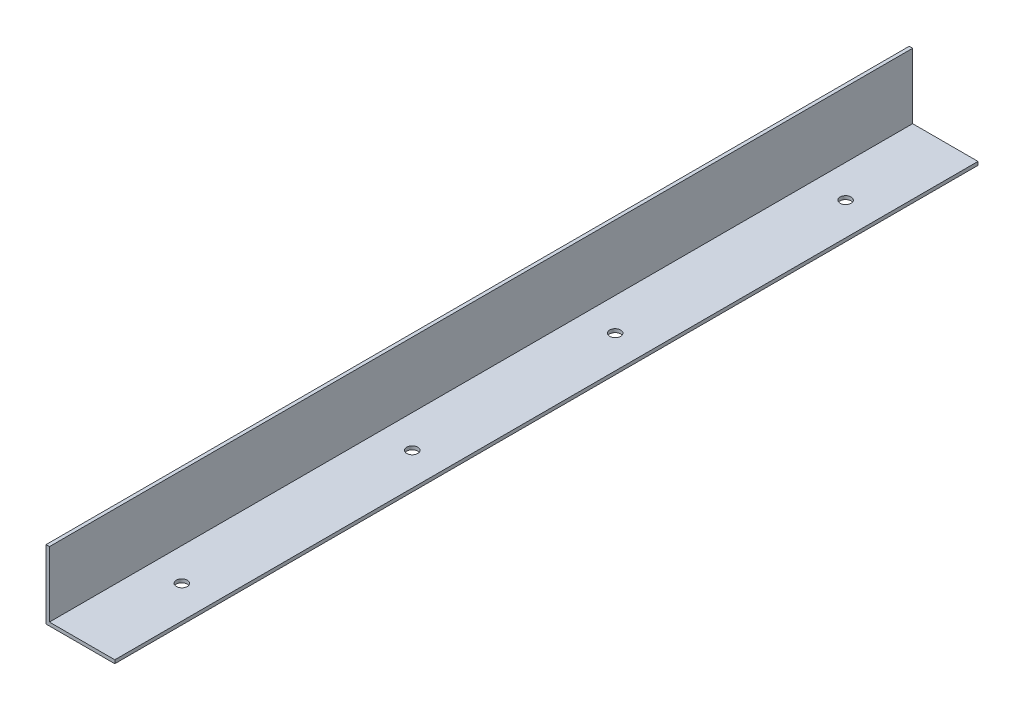
from build123d import *

# Parameters (mm, degrees)
EXTRUDE_1_DEPTH     = 251
SKETCH_2_R          = 1.6
CUT_EXTRUDE_1_DEPTH = 253.511385882


with BuildPart() as part:
    # Эскиз1 → Бобышка-Вытянуть1 (new body)
    with BuildSketch(Plane.XY):
        Polygon((0, 0), (0, 20), (1, 20), (1, 1), (20, 1), (20, 0), align=None)
    extrude(amount=EXTRUDE_1_DEPTH)

    # Эскиз2 → Вырез-Вытянуть1 (cut, through all)
    with BuildSketch(Plane(origin=(0, 1, 0), x_dir=(1, 0, 0), z_dir=(0, 1, 0))):
        with Locations((10.5, -29)):
            Circle(SKETCH_2_R)
        with Locations((10.5, -96)):
            Circle(SKETCH_2_R)
        with Locations((10.5, -222)):
            Circle(SKETCH_2_R)
        with Locations((10.5, -155)):
            Circle(SKETCH_2_R)
    extrude(amount=-CUT_EXTRUDE_1_DEPTH, mode=Mode.SUBTRACT)


solid = part.part
